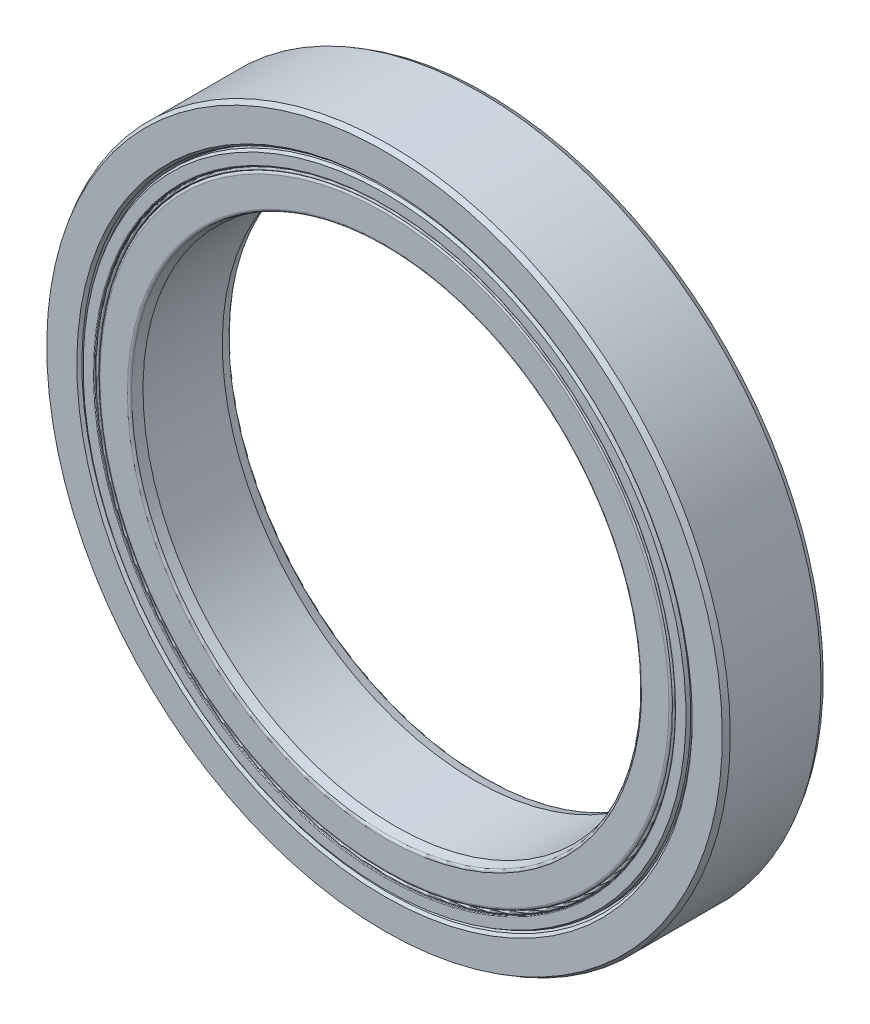
from build123d import *

# Parameters (mm, degrees)
CIRPATTERN1_COUNT = 18


with BuildPart() as part:
    # Sketch3 → Revolve1 (revolve)
    with BuildSketch(Plane(origin=(0, 0, 0), x_dir=(0, 0, -1), z_dir=(1, 0, 0))):
        with BuildLine():
            Line((-1.682987285, 12.015), (-1.9, 12.093986169))
            Line((-1.9, 12.093986169), (-2, 12.193986169))
            Line((-2, 12.193986169), (-2, 13.384529946))
            Line((-2, 13.384529946), (-1.8, 13.5))
            Line((-1.8, 13.5), (1.8, 13.5))
            Line((1.8, 13.5), (2, 13.384529946))
            Line((2, 13.384529946), (2, 12.193986169))
            Line((2, 12.193986169), (1.9, 12.093986169))
            Line((1.9, 12.093986169), (1.682987285, 12.015))
            Line((1.682987285, 12.015), (1.272261766, 12.015))
            ThreePointArc((1.272261766, 12.015), (0, 13.005), (-1.272261766, 12.015))
            Line((-1.272261766, 12.015), (-1.682987285, 12.015))
        make_face()
    revolve(axis=Axis((0, 0, 2), (0, 0, -1)))


with BuildPart() as body_2:
    # Sketch4 → Revolve2 (revolve)
    with BuildSketch(Plane(origin=(0, 0, 0), x_dir=(0, 0, -1), z_dir=(1, 0, 0))):
        with BuildLine():
            Line((-1.572559109, 10), (-1.927103936, 10.095))
            ThreePointArc((-1.927103936, 10.095), (-1.979676045, 10.13012756), (-2, 10.19))
            Line((-2, 10.19), (-2, 11.271648763))
            ThreePointArc((-2, 11.271648763), (-1.97119359, 11.34119359), (-1.901648763, 11.37))
            Line((-1.901648763, 11.37), (-1.272261766, 11.37))
            ThreePointArc((-1.272261766, 11.37), (0, 10.38), (1.272261766, 11.37))
            Line((1.272261766, 11.37), (1.901648763, 11.37))
            ThreePointArc((1.901648763, 11.37), (1.97119359, 11.34119359), (2, 11.271648763))
            Line((2, 11.271648763), (2, 10.19))
            ThreePointArc((2, 10.19), (1.979676045, 10.13012756), (1.927103936, 10.095))
            Line((1.927103936, 10.095), (1.572559109, 10))
            Line((1.572559109, 10), (-1.572559109, 10))
        make_face()
    revolve(axis=Axis((0, 0, 2), (0, 0, -1)))


with BuildPart() as body_3:
    # Sketch5 → Revolve3 (revolve)
    with BuildSketch(Plane(origin=(0, 0, 0), x_dir=(0, 0, -1), z_dir=(1, 0, 0))):
        with BuildLine():
            Line((-1.3125, 11.6925), (1.3125, 11.6925))
            ThreePointArc((1.3125, 11.6925), (0, 13.005), (-1.3125, 11.6925))
        make_face()
    revolve(axis=Axis((0, 11.6925, 1.3125), (0, 0, -1)))


with BuildPart() as cirpattern1_1:
    # CirPattern1: pattern copy
    add(body_3.part.rotate(Axis((0, 0, 2), (0, 0, -1)), 1 * 360 / CIRPATTERN1_COUNT))


with BuildPart() as cirpattern1_2:
    # CirPattern1: pattern copy
    add(body_3.part.rotate(Axis((0, 0, 2), (0, 0, -1)), 2 * 360 / CIRPATTERN1_COUNT))


with BuildPart() as cirpattern1_3:
    # CirPattern1: pattern copy
    add(body_3.part.rotate(Axis((0, 0, 2), (0, 0, -1)), 3 * 360 / CIRPATTERN1_COUNT))


with BuildPart() as cirpattern1_4:
    # CirPattern1: pattern copy
    add(body_3.part.rotate(Axis((0, 0, 2), (0, 0, -1)), 4 * 360 / CIRPATTERN1_COUNT))


with BuildPart() as cirpattern1_5:
    # CirPattern1: pattern copy
    add(body_3.part.rotate(Axis((0, 0, 2), (0, 0, -1)), 5 * 360 / CIRPATTERN1_COUNT))


with BuildPart() as cirpattern1_6:
    # CirPattern1: pattern copy
    add(body_3.part.rotate(Axis((0, 0, 2), (0, 0, -1)), 6 * 360 / CIRPATTERN1_COUNT))


with BuildPart() as cirpattern1_7:
    # CirPattern1: pattern copy
    add(body_3.part.rotate(Axis((0, 0, 2), (0, 0, -1)), 7 * 360 / CIRPATTERN1_COUNT))


with BuildPart() as cirpattern1_8:
    # CirPattern1: pattern copy
    add(body_3.part.rotate(Axis((0, 0, 2), (0, 0, -1)), 8 * 360 / CIRPATTERN1_COUNT))


with BuildPart() as cirpattern1_9:
    # CirPattern1: pattern copy
    add(body_3.part.rotate(Axis((0, 0, 2), (0, 0, -1)), 9 * 360 / CIRPATTERN1_COUNT))


with BuildPart() as cirpattern1_10:
    # CirPattern1: pattern copy
    add(body_3.part.rotate(Axis((0, 0, 2), (0, 0, -1)), 10 * 360 / CIRPATTERN1_COUNT))


with BuildPart() as cirpattern1_11:
    # CirPattern1: pattern copy
    add(body_3.part.rotate(Axis((0, 0, 2), (0, 0, -1)), 11 * 360 / CIRPATTERN1_COUNT))


with BuildPart() as cirpattern1_12:
    # CirPattern1: pattern copy
    add(body_3.part.rotate(Axis((0, 0, 2), (0, 0, -1)), 12 * 360 / CIRPATTERN1_COUNT))


with BuildPart() as cirpattern1_13:
    # CirPattern1: pattern copy
    add(body_3.part.rotate(Axis((0, 0, 2), (0, 0, -1)), 13 * 360 / CIRPATTERN1_COUNT))


with BuildPart() as cirpattern1_14:
    # CirPattern1: pattern copy
    add(body_3.part.rotate(Axis((0, 0, 2), (0, 0, -1)), 14 * 360 / CIRPATTERN1_COUNT))


with BuildPart() as cirpattern1_15:
    # CirPattern1: pattern copy
    add(body_3.part.rotate(Axis((0, 0, 2), (0, 0, -1)), 15 * 360 / CIRPATTERN1_COUNT))


with BuildPart() as cirpattern1_16:
    # CirPattern1: pattern copy
    add(body_3.part.rotate(Axis((0, 0, 2), (0, 0, -1)), 16 * 360 / CIRPATTERN1_COUNT))


with BuildPart() as cirpattern1_17:
    # CirPattern1: pattern copy
    add(body_3.part.rotate(Axis((0, 0, 2), (0, 0, -1)), 17 * 360 / CIRPATTERN1_COUNT))


with BuildPart() as body_21:
    # Sketch6 → Revolve4 (revolve)
    with BuildSketch(Plane(origin=(0, 0, 0), x_dir=(0, 0, -1), z_dir=(1, 0, 0))):
        with BuildLine():
            Line((-1.878756443, 12.015), (-1.3125, 12.015))
            Line((-1.3125, 12.015), (-1.3125, 11.51))
            Line((-1.3125, 11.51), (-1.972, 11.51))
            ThreePointArc((-1.972, 11.51), (-1.99179899, 11.51820101), (-2, 11.538))
            Line((-2, 11.538), (-2, 11.945))
            Line((-2, 11.945), (-1.878756443, 12.015))
        make_face()
        with BuildLine():
            Line((1.972, 11.51), (1.3125, 11.51))
            Line((1.3125, 11.51), (1.3125, 12.015))
            Line((1.3125, 12.015), (1.878756443, 12.015))
            Line((1.878756443, 12.015), (2, 11.945))
            Line((2, 11.945), (2, 11.538))
            ThreePointArc((2, 11.538), (1.99179899, 11.51820101), (1.972, 11.51))
        make_face()
    revolve(axis=Axis((0, 0, 2), (0, 0, -1)))


with BuildPart() as body_22:
    # Sketch7 → Revolve5 (revolve)
    with BuildSketch(Plane(origin=(0, 0, 0), x_dir=(0, 0, -1), z_dir=(1, 0, 0))):
        with BuildLine():
            Line((-1.3125, 11.51), (-1.890562103, 11.51))
            Line((-1.890562103, 11.51), (-1.925030375, 11.503922314))
            ThreePointArc((-1.925030375, 11.503922314), (-1.937016396, 11.488301826), (-1.9225, 11.475))
            Line((-1.9225, 11.475), (-1.9475, 11.475))
            ThreePointArc((-1.9475, 11.475), (-2, 11.4225), (-1.9475, 11.37))
            Line((-1.9475, 11.37), (-1.3125, 11.37))
            Line((-1.3125, 11.37), (-1.3125, 11.51))
        make_face()
    revolve(axis=Axis((0, 0, 2), (0, 0, -1)))


solid = Compound([part.part, body_2.part, body_3.part, cirpattern1_1.part, cirpattern1_2.part, cirpattern1_3.part, cirpattern1_4.part, cirpattern1_5.part, cirpattern1_6.part, cirpattern1_7.part, cirpattern1_8.part, cirpattern1_9.part, cirpattern1_10.part, cirpattern1_11.part, cirpattern1_12.part, cirpattern1_13.part, cirpattern1_14.part, cirpattern1_15.part, cirpattern1_16.part, cirpattern1_17.part, body_21.part, body_22.part])
